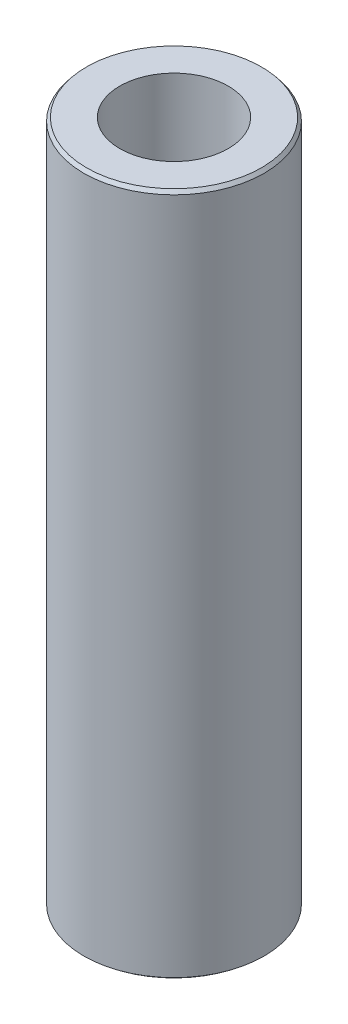
from build123d import *
from OCP.BRepFilletAPI import BRepFilletAPI_MakeChamfer

# Parameters (mm, degrees)
SKETCH1_R           = 15
BOSS_EXTRUDE1_DEPTH = 113.818768586
SKETCH2_R           = 9.022543163
CUT_EXTRUDE1_DEPTH  = 116.778720335
CHAMFER1_SIZE       = 0.567942499
CHAMFER1_SIZE2      = 0.449791564


with BuildPart() as part:
    # Sketch1 → Boss-Extrude1 (new body)
    with BuildSketch(Plane(origin=(0, 0, 0), x_dir=(1, 0, 0), z_dir=(0, 1, 0))):
        Circle(SKETCH1_R)
    extrude(amount=BOSS_EXTRUDE1_DEPTH)

    # Sketch2 → Cut-Extrude1 (cut, through all)
    with BuildSketch(Plane(origin=(0, 0, 0), x_dir=(1, 0, 0), z_dir=(0, 1, 0))):
        Circle(SKETCH2_R)
    extrude(amount=CUT_EXTRUDE1_DEPTH, mode=Mode.SUBTRACT)

    # Chamfer1: one chamfer whose edges measure the first distance from different faces: ONE call of the kernel's chamfer builder (chamfer() names one face for all edges)
    chamfer1_edges_1 = [part.edges().sort_by_distance(p)[0] for p in [
        (-15, 113.818768586, 0),
    ]]
    chamfer1_side_1 = [part.faces().sort_by_distance(p)[0] for p in [
        (-15, 56.909384293, 0),
    ]]
    chamfer1_edges_2 = [part.edges().sort_by_distance(p)[0] for p in [
        (-15, 0, 0),
    ]]
    chamfer1_side_2 = [part.faces().sort_by_distance(p)[0] for p in [
        (-14.575735931, 0, 0),
    ]]
    chamfer1 = BRepFilletAPI_MakeChamfer(part.part.solid().wrapped)
    for e in chamfer1_edges_1:
        chamfer1.Add(CHAMFER1_SIZE, CHAMFER1_SIZE2, e.wrapped, chamfer1_side_1[0].wrapped)  # the first distance lies on this face
    for e in chamfer1_edges_2:
        chamfer1.Add(CHAMFER1_SIZE, CHAMFER1_SIZE2, e.wrapped, chamfer1_side_2[0].wrapped)  # the first distance lies on this face
    add(Compound.cast(chamfer1.Shape()), mode=Mode.REPLACE)


solid = part.part
